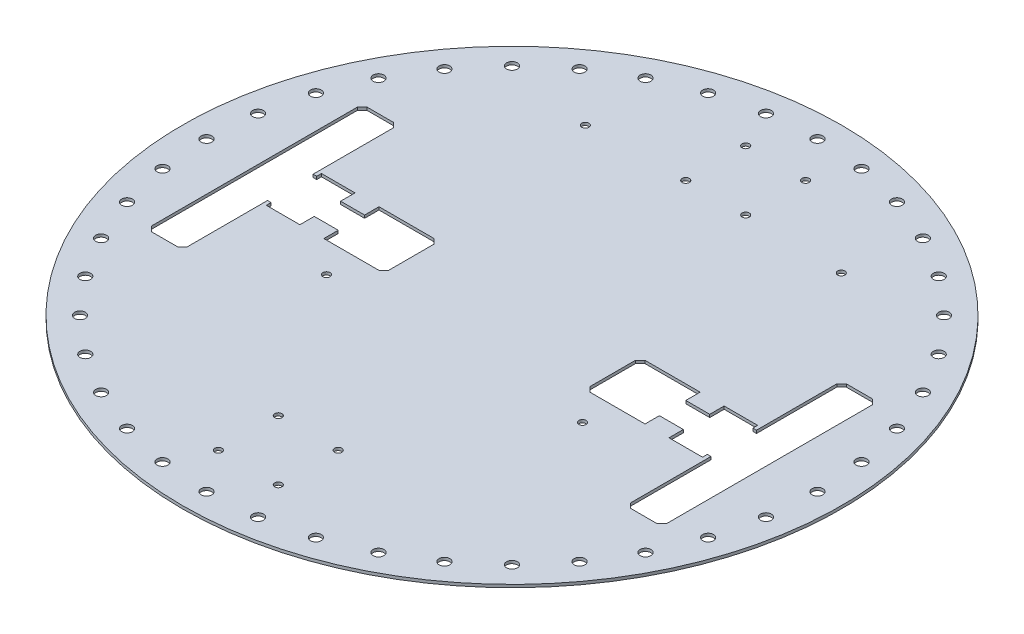
from build123d import *

# Parameters (mm, degrees)
SKETCH1_R           = 137.5
BOSS_EXTRUDE1_DEPTH = 1.2
SKETCH3_R           = 2.25
CUT_EXTRUDE1_DEPTH  = 195.458067459
CUT_EXTRUDE2_DEPTH  = 1.2
SKETCH5_R           = 1.5
CUT_EXTRUDE3_DEPTH  = 195.458067459
SKETCH6_R           = 1.5
CUT_EXTRUDE4_DEPTH  = 195.458067459


with BuildPart() as part:
    # Sketch1 → Boss-Extrude1 (new body)
    with BuildSketch(Plane(origin=(0, 0, 0), x_dir=(1, 0, 0), z_dir=(0, 1, 0))):
        Circle(SKETCH1_R)
    extrude(amount=BOSS_EXTRUDE1_DEPTH)

    # Sketch3 → Cut-Extrude1 (cut, through all)
    with BuildSketch(Plane(origin=(0, 1.2, 0), x_dir=(1, 0, 0), z_dir=(0, 1, 0))):
        with Locations((0, 127.454948432)):
            Circle(SKETCH3_R)
        with Locations((19.938346675, 125.885766517)):
            Circle(SKETCH3_R)
        with Locations((39.385745083, 121.21685924)):
            Circle(SKETCH3_R)
        with Locations((57.863335733, 113.563190593)):
            Circle(SKETCH3_R)
        with Locations((74.91613902, 103.113219299)):
            Circle(SKETCH3_R)
        with Locations((90.124258332, 90.124258332)):
            Circle(SKETCH3_R)
        with Locations((103.113219299, 74.91613902)):
            Circle(SKETCH3_R)
        with Locations((113.563190593, 57.863335733)):
            Circle(SKETCH3_R)
        with Locations((121.21685924, 39.385745083)):
            Circle(SKETCH3_R)
        with Locations((125.885766517, 19.938346675)):
            Circle(SKETCH3_R)
        with Locations((127.454948432, 0)):
            Circle(SKETCH3_R)
        with Locations((125.885766517, -19.938346675)):
            Circle(SKETCH3_R)
        with Locations((121.21685924, -39.385745083)):
            Circle(SKETCH3_R)
        with Locations((113.563190593, -57.863335733)):
            Circle(SKETCH3_R)
        with Locations((103.113219299, -74.91613902)):
            Circle(SKETCH3_R)
        with Locations((90.124258332, -90.124258332)):
            Circle(SKETCH3_R)
        with Locations((74.91613902, -103.113219299)):
            Circle(SKETCH3_R)
        with Locations((57.863335733, -113.563190593)):
            Circle(SKETCH3_R)
        with Locations((39.385745083, -121.21685924)):
            Circle(SKETCH3_R)
        with Locations((19.938346675, -125.885766517)):
            Circle(SKETCH3_R)
        with Locations((0, -127.454948432)):
            Circle(SKETCH3_R)
        with Locations((-19.938346675, -125.885766517)):
            Circle(SKETCH3_R)
        with Locations((-39.385745083, -121.21685924)):
            Circle(SKETCH3_R)
        with Locations((-57.863335733, -113.563190593)):
            Circle(SKETCH3_R)
        with Locations((-74.91613902, -103.113219299)):
            Circle(SKETCH3_R)
        with Locations((-90.124258332, -90.124258332)):
            Circle(SKETCH3_R)
        with Locations((-103.113219299, -74.91613902)):
            Circle(SKETCH3_R)
        with Locations((-113.563190593, -57.863335733)):
            Circle(SKETCH3_R)
        with Locations((-121.21685924, -39.385745083)):
            Circle(SKETCH3_R)
        with Locations((-125.885766517, -19.938346675)):
            Circle(SKETCH3_R)
        with Locations((-127.454948432, 0)):
            Circle(SKETCH3_R)
        with Locations((-125.885766517, 19.938346675)):
            Circle(SKETCH3_R)
        with Locations((-121.21685924, 39.385745083)):
            Circle(SKETCH3_R)
        with Locations((-113.563190593, 57.863335733)):
            Circle(SKETCH3_R)
        with Locations((-103.113219299, 74.91613902)):
            Circle(SKETCH3_R)
        with Locations((-90.124258332, 90.124258332)):
            Circle(SKETCH3_R)
        with Locations((-74.91613902, 103.113219299)):
            Circle(SKETCH3_R)
        with Locations((-57.863335733, 113.563190593)):
            Circle(SKETCH3_R)
        with Locations((-39.385745083, 121.21685924)):
            Circle(SKETCH3_R)
        with Locations((-19.938346675, 125.885766517)):
            Circle(SKETCH3_R)
    extrude(amount=-CUT_EXTRUDE1_DEPTH, mode=Mode.SUBTRACT)

    # Sketch4 → Cut-Extrude2 (cut)
    with BuildSketch(Plane(origin=(0, 1.2, 0), x_dir=(1, 0, 0), z_dir=(0, 1, 0))):
        Polygon((-107.5, -43), (-107.5, 43), (-105.5, 45), (-94.5, 45), (-92.5, 43), (-92.5, 9.5), (-91, 9.5), (-91, 11.5), (-77, 11.5), (-77, 5.5), (-67, 5.5), (-67, 11.5), (-44, 11.5), (-42, 9.5), (-42, -9.5), (-44, -11.5), (-67, -11.5), (-67, -5.5), (-77, -5.5), (-77, -11.5), (-91, -11.5), (-91, -9.5), (-92.5, -9.5), (-92.5, -43), (-94.5, -45), (-105.5, -45), align=None)
        Polygon((94.5, -45), (92.5, -43), (92.5, -9.5), (91, -9.5), (91, -11.5), (77, -11.5), (77, -5.5), (67, -5.5), (67, -11.5), (44, -11.5), (42, -9.5), (42, 9.5), (44, 11.5), (67, 11.5), (67, 5.5), (77, 5.5), (77, 11.5), (91, 11.5), (91, 9.5), (92.5, 9.5), (92.5, 43), (94.5, 45), (105.5, 45), (107.5, 43), (107.5, -43), (105.5, -45), align=None)
    extrude(amount=-CUT_EXTRUDE2_DEPTH, mode=Mode.SUBTRACT)

    # Sketch5 → Cut-Extrude3 (cut, through all)
    with BuildSketch(Plane(origin=(0, 1.2, 0), x_dir=(1, 0, 0), z_dir=(0, 1, 0))):
        with Locations((-53.4, 84)):
            Circle(SKETCH5_R)
        with Locations((53.4, 84)):
            Circle(SKETCH5_R)
        with Locations((53.4, -24)):
            Circle(SKETCH5_R)
        with Locations((-53.4, -24)):
            Circle(SKETCH5_R)
    extrude(amount=-CUT_EXTRUDE3_DEPTH, mode=Mode.SUBTRACT)

    # Sketch6 → Cut-Extrude4 (cut, through all)
    with BuildSketch(Plane(origin=(0, 1.2, 0), x_dir=(1, 0, 0), z_dir=(0, 1, 0))):
        with Locations((-12.5, 110)):
            Circle(SKETCH6_R)
        with Locations((12.5, 110)):
            Circle(SKETCH6_R)
        with Locations((12.5, 85)):
            Circle(SKETCH6_R)
        with Locations((-12.5, 85)):
            Circle(SKETCH6_R)
        with Locations((-12.5, -85)):
            Circle(SKETCH6_R)
        with Locations((12.5, -85)):
            Circle(SKETCH6_R)
        with Locations((12.5, -110)):
            Circle(SKETCH6_R)
        with Locations((-12.5, -110)):
            Circle(SKETCH6_R)
    extrude(amount=-CUT_EXTRUDE4_DEPTH, mode=Mode.SUBTRACT)


solid = part.part
